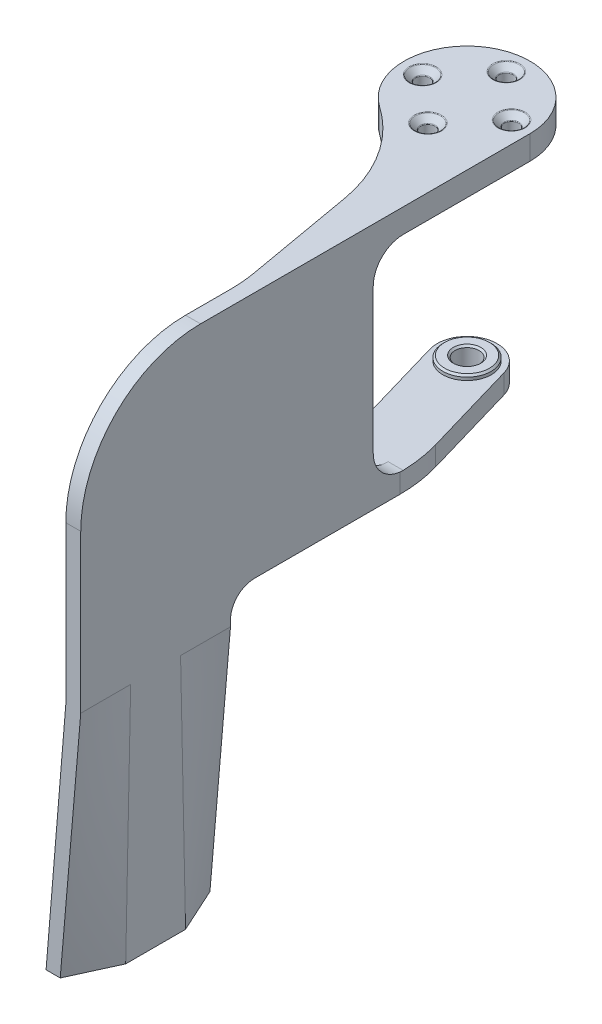
from build123d import *

# Parameters (mm, degrees)
BOSS_EXTRUDE1_DEPTH                                 = 4
CSK_FOR_M2_COUNTERSUNK_FLAT_HEAD_SCREW1_D           = 2.4
CSK_FOR_M2_COUNTERSUNK_FLAT_HEAD_SCREW1_DEPTH       = 4
CSK_FOR_M2_COUNTERSUNK_FLAT_HEAD_SCREW1_CSINK_D     = 4.4
CSK_FOR_M2_COUNTERSUNK_FLAT_HEAD_SCREW1_CSINK_ANGLE = 90
CSK_FOR_M2_COUNTERSUNK_FLAT_HEAD_SCREW1_TIP         = 0.721032743
CUT_EXTRUDE1_DEPTH                                  = 1
BOSS_EXTRUDE2_START                                 = 0.2
SKETCH6_R                                           = 4.038121114
BOSS_EXTRUDE2_DEPTH                                 = 0.8
BOSS_EXTRUDE3_DEPTH                                 = 3.2
SKETCH10_R                                          = 2
CUT_EXTRUDE2_DEPTH                                  = 5
SKETCH11_R                                          = 3.75
CUT_EXTRUDE3_DEPTH                                  = 0.4
SKETCH12_W                                          = 2.5
SKETCH12_H                                          = 25
BOSS_EXTRUDE4_DEPTH                                 = 46.3
SKETCH15_W                                          = 23.833168605
SKETCH15_H                                          = 34.1
BOSS_EXTRUDE5_DEPTH                                 = 2.5
FILLET1_R                                           = 5
FILLET2_R                                           = 20
CHAMFER1_SIZE                                       = 0.3
FILLET3_R                                           = 0.2
CHAMFER2_SIZE                                       = 0.5
FILLET4_R                                           = 0.2
FILLET6_R                                           = 25
FILLET7_R                                           = 4


with BuildPart() as part:
    # Sketch2 → Boss-Extrude1 (new body)
    with BuildSketch(Plane(origin=(0, 33.6, 0), x_dir=(1, 0, 0), z_dir=(0, 1, 0))):
        with BuildLine():
            Line((14.908174518, 11.59247222), (14.908174518, -33.747082129))
            Line((14.908174518, -33.747082129), (14.908174518, -63.40752778))
            Line((14.908174518, -63.40752778), (12.408174518, -63.40752778))
            Line((12.408174518, -63.40752778), (12.408174518, -33.747082129))
            Line((12.408174518, -33.747082129), (6.236730193, 1.252917871))
            ThreePointArc((6.236730193, 1.252917871), (-3.637005238, 18.339699999), (14.908174518, 11.59247222))
        make_face()
    extrude(amount=BOSS_EXTRUDE1_DEPTH)

    # CSK for M2 Countersunk Flat Head Screw1
    with Locations(Plane(origin=(0, 37.6, 0), x_dir=(1, 0, 0), z_dir=(0, 1, 0))):
        with Locations((4.847208305, 4.606253691), (11.394393047, 12.031506008), (3.96914073, 18.578690749), (-2.578044011, 11.153438432)):
            CounterSinkHole(CSK_FOR_M2_COUNTERSUNK_FLAT_HEAD_SCREW1_D / 2, CSK_FOR_M2_COUNTERSUNK_FLAT_HEAD_SCREW1_CSINK_D / 2, depth=CSK_FOR_M2_COUNTERSUNK_FLAT_HEAD_SCREW1_DEPTH, counter_sink_angle=CSK_FOR_M2_COUNTERSUNK_FLAT_HEAD_SCREW1_CSINK_ANGLE)
            with Locations((0, 0, -(CSK_FOR_M2_COUNTERSUNK_FLAT_HEAD_SCREW1_DEPTH + CSK_FOR_M2_COUNTERSUNK_FLAT_HEAD_SCREW1_TIP / 2))):  # 118° drill point
                Cone(0, CSK_FOR_M2_COUNTERSUNK_FLAT_HEAD_SCREW1_D / 2, CSK_FOR_M2_COUNTERSUNK_FLAT_HEAD_SCREW1_TIP, mode=Mode.SUBTRACT)

    # Sketch5 → Cut-Extrude1 (cut)
    with BuildSketch(Plane.XZ.offset(-33.6)):
        with BuildLine():
            Line((-0.091825482, -22.09247222), (-0.091825482, -11.59247222))
            ThreePointArc((-0.091825482, -11.59247222), (4.408174518, -7.09247222), (8.908174518, -11.59247222))
            Line((8.908174518, -11.59247222), (8.908174518, -22.09247222))
            ThreePointArc((8.908174518, -22.09247222), (4.408174518, -26.59247222), (-0.091825482, -22.09247222))
        make_face()
    extrude(amount=-CUT_EXTRUDE1_DEPTH, mode=Mode.SUBTRACT)



with BuildPart() as body_2:
    # Sketch6 → Boss-Extrude2 (new body)
    with BuildSketch(Plane.XZ.offset(-0.5).offset(BOSS_EXTRUDE2_START)):
        with Locations(Location((4.408174518, -11.59247222, 0), (0, 0, 270))):
            Circle(SKETCH6_R)
    extrude(amount=BOSS_EXTRUDE2_DEPTH)

    # Sketch7 → Boss-Extrude3 (add)
    with BuildSketch(Plane.XZ.offset(0.5)):
        with BuildLine():
            Line((-0.392286371, -10.194053378), (12.408174518, 33.747082129))
            Line((12.408174518, 33.747082129), (12.408174518, 63.40752778))
            Line((12.408174518, 63.40752778), (14.908174518, 63.40752778))
            Line((14.908174518, 63.40752778), (14.908174518, 6.574359175))
            Line((14.908174518, 6.574359175), (9.208635406, -12.990891062))
            ThreePointArc((9.208635406, -12.990891062), (3.009755675, -16.392933108), (-0.392286371, -10.194053378))
        make_face()
    extrude(amount=BOSS_EXTRUDE3_DEPTH)

    # Sketch10 → Cut-Extrude2 (cut)
    with BuildSketch(Plane.XZ.offset(3.7)):
        with Locations(Location((4.408174518, -11.59247222, 0), (0, 0, 270))):
            Circle(SKETCH10_R)
    extrude(amount=-CUT_EXTRUDE2_DEPTH, mode=Mode.SUBTRACT)

    # Sketch11 → Cut-Extrude3 (cut)
    with BuildSketch(Plane.XZ.offset(3.7)):
        with Locations(Location((4.408174518, -11.59247222, 0), (0, 0, 270))):
            Circle(SKETCH11_R)
    extrude(amount=-CUT_EXTRUDE3_DEPTH, mode=Mode.SUBTRACT)


with BuildPart() as part_1:
    add(part.part)

    add(body_2.part)  # Boss-Extrude4 merges body 2
    # Sketch12 → Boss-Extrude4 (add)
    with BuildSketch(Plane(origin=(0, 37.6, 0), x_dir=(1, 0, 0), z_dir=(0, 1, 0))):
        with Locations((13.658174518, -50.90752778)):
            Rectangle(SKETCH12_W, SKETCH12_H)
    extrude(amount=-BOSS_EXTRUDE4_DEPTH)

    # Sketch15 → Boss-Extrude5 (add)
    with BuildSketch(Plane(origin=(14.908174518, 0, 0), x_dir=(0, 0, -1), z_dir=(1, 0, 0))):
        with Locations((-26.490943478, 16.55)):
            Rectangle(SKETCH15_W, SKETCH15_H)
    extrude(amount=-BOSS_EXTRUDE5_DEPTH)

    # Fillet1
    fillet1_edges = [part_1.edges().sort_by_distance(p)[0] for p in [
        (13.658174518, 33.6, 14.574359175),
        (13.658174518, -0.5, 14.574359175),
    ]]
    fillet(fillet1_edges, radius=FILLET1_R)

    # Fillet2
    fillet2_edges = [part_1.edges().sort_by_distance(p)[0] for p in [
        (13.658174518, 37.6, 63.40752778),
    ]]
    fillet(fillet2_edges, radius=FILLET2_R)

    # Chamfer1
    chamfer1_edges = [part_1.edges().sort_by_distance(p)[0] for p in [
        (4.408174518, 0.3, -7.554351106),
        (4.408174518, 0.3, -9.59247222),
    ]]
    chamfer(chamfer1_edges, length=CHAMFER1_SIZE)

    # Fillet3
    fillet3_edges = [part_1.edges().sort_by_distance(p)[0] for p in [
        (4.408174518, -3.3, -7.84247222),
        (4.408174518, -3.3, -9.59247222),
    ]]
    fillet(fillet3_edges, radius=FILLET3_R)

    # Chamfer2
    # the kernel refuses this chamfer: 0.5, 0.37535302 mm, written as the material it takes off along each edge
    with BuildSketch(Plane(origin=(-0.091825482, 34.6, -21.0793052), x_dir=(-0.8957520847701, 0, 0.4445539366938725), z_dir=(0, -1, 0))) as chamfer2_piece_1:
        with BuildLine():
            Line((0.373049134, 0), (CHAMFER2_SIZE * 0.444553936694, -CHAMFER2_SIZE * 0.89575208477))
            Line((CHAMFER2_SIZE * 0.444553936694, -CHAMFER2_SIZE * 0.89575208477), (0, 0))
            ThreePointArc((0, 0), (0.189712645, 0.001656381), (0.373049134, 0))
        make_face()
    extrude(amount=2.285841494, mode=Mode.SUBTRACT)
    with BuildSketch(Plane(origin=(8.908174518, 34.6, -21.0793052), x_dir=(0.895752084770101, 0, 0.4445539366938706), z_dir=(0, -1, 0))) as chamfer2_piece_2:
        with BuildLine():
            Line((0.373049134, 0), (CHAMFER2_SIZE * 0.444553936694, CHAMFER2_SIZE * 0.89575208477))
            Line((CHAMFER2_SIZE * 0.444553936694, CHAMFER2_SIZE * 0.89575208477), (0, 0))
            ThreePointArc((0, 0), (0.189712645, -0.001656381), (0.373049134, 0))
        make_face()
    extrude(amount=2.285841494, mode=Mode.SUBTRACT)
    with BuildSketch(Plane(origin=(4.408174518, 34.6, -11.59247222), x_dir=(-0.5357432905270894, 0, -0.8443809132466265), z_dir=(-0.8443809132466265, 0, 0.5357432905270894))) as chamfer2_piece_3_section:
        Polygon((10.5, -CHAMFER2_SIZE), (10.5 - CHAMFER2_SIZE, 0), (10.5, 0), align=None)
    chamfer2_piece_3 = revolve(axis=Axis((4.408174518, 34.6, -11.59247222), (0, -1, 0)), revolution_arc=64.788667193, mode=Mode.PRIVATE)
    chamfer2_piece_3 = split(chamfer2_piece_3, bisect_by=Plane(origin=(-0.091825482, 34.6, -11.59247222), z_dir=(1, 0, 0)), keep=Keep.TOP, mode=Mode.PRIVATE)
    chamfer2_piece_3 = split(chamfer2_piece_3, bisect_by=Plane(origin=(8.908174518, 34.6, -11.59247222), z_dir=(-1, 0, 0)), keep=Keep.TOP, mode=Mode.PRIVATE)
    add(chamfer2_piece_3, mode=Mode.SUBTRACT)
    with BuildSketch(Plane(origin=(-0.091825482, 35.885841494, -21.0793052), x_dir=(-0.8957520847701, 0, 0.4445539366938725), z_dir=(0, -1, 0))) as chamfer2_piece_4a_section:
        with BuildLine():
            Line((0.373049134, 0), (CHAMFER2_SIZE * 0.444553936694, -CHAMFER2_SIZE * 0.89575208477))
            Line((CHAMFER2_SIZE * 0.444553936694, -CHAMFER2_SIZE * 0.89575208477), (0, 0))
            ThreePointArc((0, 0), (0.189712645, 0.001656381), (0.373049134, 0))
        make_face()
    chamfer2_piece_4a = extrude(amount=3.571682988, mode=Mode.PRIVATE)
    chamfer2_piece_4a = split(chamfer2_piece_4a, bisect_by=Plane(origin=(-0.091825482, 34.6, -21.0793052), z_dir=(0, 1, 0)), keep=Keep.TOP, mode=Mode.PRIVATE)
    with BuildSketch(Plane(origin=(4.408174518, 34.6, -11.59247222), x_dir=(-0.5357432905270894, 0, -0.8443809132466265), z_dir=(-0.8443809132466265, 0, 0.5357432905270894))) as chamfer2_piece_4b_section:
        Polygon((10.5, -CHAMFER2_SIZE), (10.5 - CHAMFER2_SIZE, 0), (10.5, 0), align=None)
    chamfer2_piece_4b = revolve(axis=Axis((4.408174518, 34.6, -11.59247222), (0, -1, 0)), revolution_arc=64.788667193, mode=Mode.PRIVATE)
    chamfer2_piece_4b = split(chamfer2_piece_4b, bisect_by=Plane(origin=(-0.091825482, 34.6, -11.59247222), z_dir=(-1, 0, 0)), keep=Keep.TOP, mode=Mode.PRIVATE)
    chamfer2_piece_4 = chamfer2_piece_4a & chamfer2_piece_4b
    add(chamfer2_piece_4, mode=Mode.SUBTRACT)
    with BuildSketch(Plane(origin=(4.408174518, 34.6, -11.59247222), x_dir=(-0.5357432905270894, 0, -0.8443809132466265), z_dir=(-0.8443809132466265, 0, 0.5357432905270894))) as chamfer2_piece_5a_section:
        Polygon((10.5, -CHAMFER2_SIZE), (10.5 - CHAMFER2_SIZE, 0), (10.5, 0), align=None)
    chamfer2_piece_5a = revolve(axis=Axis((4.408174518, 34.6, -11.59247222), (0, -1, 0)), revolution_arc=64.788667193, mode=Mode.PRIVATE)
    chamfer2_piece_5a = split(chamfer2_piece_5a, bisect_by=Plane(origin=(8.908174518, 34.6, -11.59247222), z_dir=(1, 0, 0)), keep=Keep.TOP, mode=Mode.PRIVATE)
    with BuildSketch(Plane(origin=(8.908174518, 35.885841494, -21.0793052), x_dir=(0.895752084770101, 0, 0.4445539366938706), z_dir=(0, -1, 0))) as chamfer2_piece_5b_section:
        with BuildLine():
            Line((0.373049134, 0), (CHAMFER2_SIZE * 0.444553936694, CHAMFER2_SIZE * 0.89575208477))
            Line((CHAMFER2_SIZE * 0.444553936694, CHAMFER2_SIZE * 0.89575208477), (0, 0))
            ThreePointArc((0, 0), (0.189712645, -0.001656381), (0.373049134, 0))
        make_face()
    chamfer2_piece_5b = extrude(amount=3.571682988, mode=Mode.PRIVATE)
    chamfer2_piece_5b = split(chamfer2_piece_5b, bisect_by=Plane(origin=(8.908174518, 34.6, -21.0793052), z_dir=(0, 1, 0)), keep=Keep.TOP, mode=Mode.PRIVATE)
    chamfer2_piece_5 = chamfer2_piece_5a & chamfer2_piece_5b
    add(chamfer2_piece_5, mode=Mode.SUBTRACT)

    # Fillet4
    fillet4_edges = [part_1.edges().sort_by_distance(p)[0] for p in [
        (-0.378044011, 37.6, -11.153438432),
        (-1.378044011, 33.6, -11.153438432),
        (-1.378044011, 36.6, -11.153438432),
        (6.16914073, 37.6, -18.578690749),
        (5.16914073, 36.6, -18.578690749),
        (13.594393047, 37.6, -12.031506008),
        (12.594393047, 33.6, -12.031506008),
        (12.594393047, 36.6, -12.031506008),
        (7.047208305, 37.6, -4.606253691),
        (6.047208305, 33.6, -4.606253691),
        (6.047208305, 36.6, -4.606253691),
        (5.16914073, 34.6, -18.578690749),
    ]]
    fillet(fillet4_edges, radius=FILLET4_R)

    # Fillet6
    fillet6_edges = [part_1.edges().sort_by_distance(p)[0] for p in [
        (12.408174518, 35.6, 33.747082129),
        (6.236730193, 35.6, -1.252917871),
        (14.908174518, -2.1, 6.574359175),
        (12.408174518, -2.1, 33.747082129),
    ]]
    fillet(fillet6_edges, radius=FILLET6_R)

    # Fillet7
    fillet7_edges = [part_1.edges().sort_by_distance(p)[0] for p in [
        (13.658174518, -3.7, 38.40752778),
    ]]
    fillet(fillet7_edges, radius=FILLET7_R)

    # Loft1: read off the stored shape, not the designer's step
    # Loft1: loft between two sections, ruled curve by curve
    loft1_from = [
        Edge.make_bspline([(12.408174518, -8.7, 63.40752778), (12.408174518, -8.7, 62.018638891), (12.408174518, -8.7, 60.629750002), (12.408174518, -8.7, 57.851972225), (12.408174518, -8.7, 56.463083336), (12.408174518, -8.7, 55.074194447)], [0, 0, 0, 0, 0.5, 0.5, 1, 1, 1, 1], 3),
        Edge.make_bspline([(12.408174518, -8.7, 46.740861113), (12.408174518, -8.7, 45.351972225), (12.408174518, -8.7, 43.963083336), (12.408174518, -8.7, 41.185305558), (12.408174518, -8.7, 39.796416669), (12.408174518, -8.7, 38.40752778)], [0, 0, 0, 0, 0.5, 0.5, 1, 1, 1, 1], 3),
        Edge.make_bspline([(14.908174518, -8.7, 38.40752778), (14.908174518, -8.7, 39.796416669), (14.908174518, -8.7, 41.185305558), (14.908174518, -8.7, 43.963083336), (14.908174518, -8.7, 45.351972225), (14.908174518, -8.7, 46.740861113)], [0, 0, 0, 0, 0.5, 0.5, 1, 1, 1, 1], 3),
        Edge.make_bspline([(14.908174518, -8.7, 55.074194447), (14.908174518, -8.7, 56.463083336), (14.908174518, -8.7, 57.851972225), (14.908174518, -8.7, 60.629750002), (14.908174518, -8.7, 62.018638891), (14.908174518, -8.7, 63.40752778)], [0, 0, 0, 0, 0.5, 0.5, 1, 1, 1, 1], 3),
        Edge.make_line((12.408174518, -8.7, 46.740861113), (12.408174518, -8.7, 55.074194447)),
        Edge.make_line((14.908174518, -8.7, 38.40752778), (12.408174518, -8.7, 38.40752778)),
        Edge.make_line((14.908174518, -8.7, 63.40752778), (12.408174518, -8.7, 63.40752778)),
        Edge.make_line((14.908174518, -8.7, 55.074194447), (14.908174518, -8.7, 46.740861113)),
    ]
    loft1_to = [
        Edge.make_bspline([(9.116461452, -48.7, 63.40752778), (9.748413629, -48.7, 62.024194447), (10.380365807, -48.7, 60.640861113), (11.644270162, -48.7, 57.874194447), (12.27622234, -48.7, 56.490861113), (12.908174518, -48.7, 55.10752778)], [0, 0, 0, 0, 0.5, 0.5, 1, 1, 1, 1], 3),
        Edge.make_bspline([(12.908174518, -48.7, 46.70752778), (12.27622234, -48.7, 45.324194447), (11.644270162, -48.7, 43.940861113), (10.380365807, -48.7, 41.174194447), (9.748413629, -48.7, 39.790861113), (9.116461452, -48.7, 38.40752778)], [0, 0, 0, 0, 0.5, 0.5, 1, 1, 1, 1], 3),
        Edge.make_bspline([(11.479482023, -48.7, 38.40752778), (12.050930772, -48.7, 39.658420064), (12.622379522, -48.7, 40.909312348), (13.76527702, -48.7, 43.411096916), (14.336725769, -48.7, 44.661989199), (14.908174518, -48.7, 45.912881483)], [0, 0, 0, 0, 0.5, 0.5, 1, 1, 1, 1], 3),
        Edge.make_bspline([(14.908174518, -48.7, 55.902174077), (14.336725769, -48.7, 57.153066361), (13.76527702, -48.7, 58.403958645), (12.622379522, -48.7, 60.905743212), (12.050930772, -48.7, 62.156635496), (11.479482023, -48.7, 63.40752778)], [0, 0, 0, 0, 0.5, 0.5, 1, 1, 1, 1], 3),
        Edge.make_line((12.908174518, -48.7, 46.70752778), (12.908174518, -48.7, 55.10752778)),
        Edge.make_line((11.479482023, -48.7, 38.40752778), (9.116461452, -48.7, 38.40752778)),
        Edge.make_line((11.479482023, -48.7, 63.40752778), (9.116461452, -48.7, 63.40752778)),
        Edge.make_line((14.908174518, -48.7, 55.902174077), (14.908174518, -48.7, 45.912881483)),
    ]
    loft1 = Solid(Shell([*[Face.make_surface_from_curves(loft1_from[k], loft1_to[k]) for k in range(8)], Face(Wire(loft1_from)), Face(Wire(loft1_to))]))
    add(loft1)


solid = part_1.part
